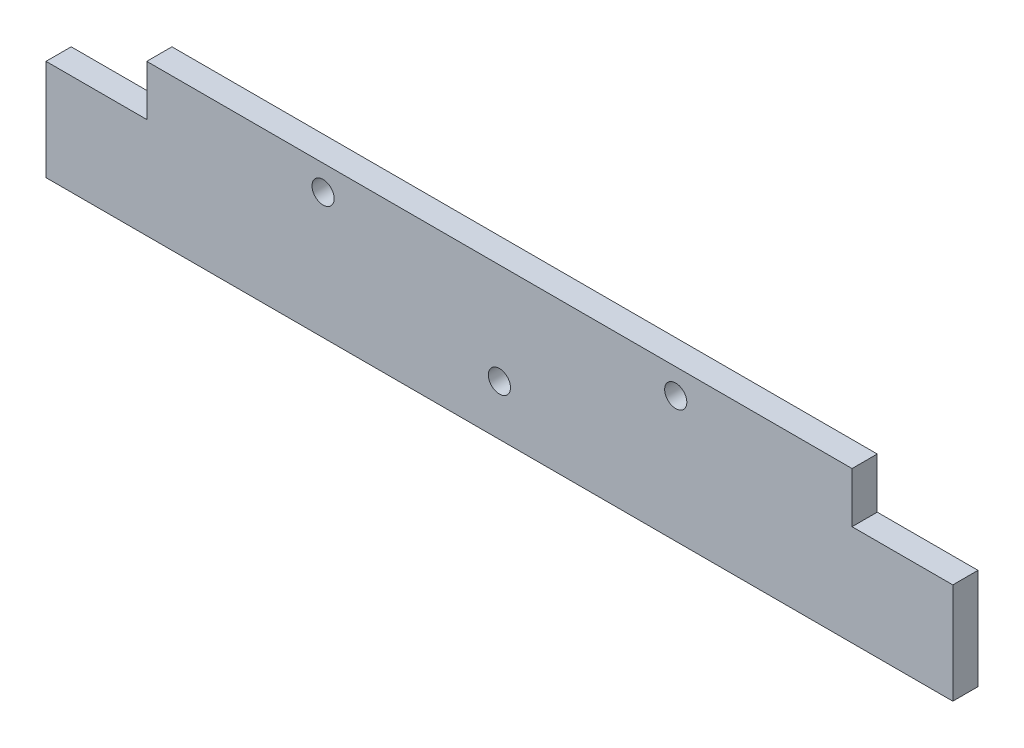
from build123d import *

# Parameters (mm, degrees)
DODANIE_WYCI_GNI_CIE1_DEPTH = 5
SZKIC2_R                    = 2.2
WYTNIJ_WYCI_GNI_CIE1_DEPTH  = 10
SZKIC6_R                    = 2.2
WYTNIJ_WYCI_GNI_CIE3_DEPTH  = 163.864974749


with BuildPart() as part:
    # Szkic1 → Dodanie-wyciągnięcie1 (new body)
    with BuildSketch(Plane.XY):
        Polygon((0, -10), (-20, -10), (-20, -30), (160, -30), (160, -10), (140, -10), (140, 0), (0, 0), align=None)
    extrude(amount=DODANIE_WYCI_GNI_CIE1_DEPTH)

    # Szkic2 → Wytnij-wyciągnięcie1 (cut)
    with BuildSketch(Plane.XY.offset(5)):
        with Locations((35, -5)):
            Circle(SZKIC2_R)
        with Locations((105, -5)):
            Circle(SZKIC2_R)
    extrude(amount=-WYTNIJ_WYCI_GNI_CIE1_DEPTH, mode=Mode.SUBTRACT)

    # Szkic6 → Wytnij-wyciągnięcie3 (cut, through all)
    with BuildSketch(Plane.XY.offset(5)):
        with Locations((70, -20)):
            Circle(SZKIC6_R)
    extrude(amount=-WYTNIJ_WYCI_GNI_CIE3_DEPTH, mode=Mode.SUBTRACT)


solid = part.part
